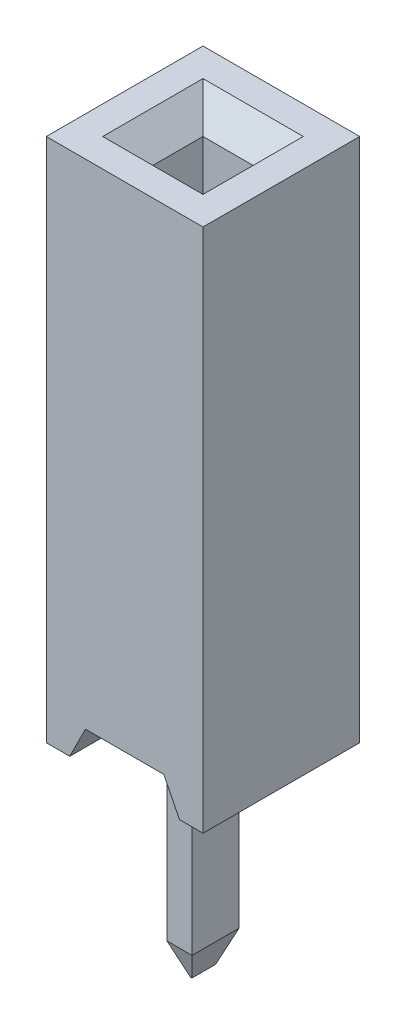
from build123d import *
from OCP.BRepFilletAPI import BRepFilletAPI_MakeChamfer

# Parameters (mm, degrees)
SKETCH1_W           = 2.54
SKETCH1_H           = 2.54
BOSS_EXTRUDE1_DEPTH = 8.509
CUT_EXTRUDE1_DEPTH  = 2.54
SKETCH3_W           = 0.4064
SKETCH3_H           = 0.762
BOSS_EXTRUDE3_DEPTH = 3.7084
CHAMFER2_SIZE       = 0.508
CHAMFER2_SIZE2      = 0.1905
SKETCH2_W           = 0.8128
SKETCH2_H           = 0.8128
CUT_EXTRUDE2_DEPTH  = 6.35
CHAMFER3_SIZE       = 0.4064


with BuildPart() as part:
    # Sketch1 → Boss-Extrude1 (new body)
    with BuildSketch(Plane(origin=(0, 0, 0), x_dir=(1, 0, 0), z_dir=(0, 1, 0))):
        with Locations((1.27, 1.27)):
            Rectangle(SKETCH1_W, SKETCH1_H)
    extrude(amount=BOSS_EXTRUDE1_DEPTH)

    # Sketch4 → Cut-Extrude1 (cut)
    with BuildSketch(Plane(origin=(0, 0, -2.54), x_dir=(-1, 0, 0), z_dir=(0, 0, -1))):
        Polygon((-0.635, 0.508), (-1.905, 0.508), (-2.159, 0), (-0.381, 0), align=None)
    extrude(amount=-CUT_EXTRUDE1_DEPTH, mode=Mode.SUBTRACT)

    # Sketch3 → Boss-Extrude3 (add)
    with BuildSketch(Plane.XZ.offset(-0.508)):
        with Locations((1.27, -1.27)):
            Rectangle(SKETCH3_W, SKETCH3_H)
    extrude(amount=BOSS_EXTRUDE3_DEPTH)

    # Chamfer2: one chamfer whose edges measure the first distance from different faces: ONE call of the kernel's chamfer builder (chamfer() names one face for all edges)
    chamfer2_edges_1 = [part.edges().sort_by_distance(p)[0] for p in [
        (1.4732, -3.2004, -1.27),
    ]]
    chamfer2_side_1 = [part.faces().sort_by_distance(p)[0] for p in [
        (1.4732, -1.3462, -1.27),
    ]]
    chamfer2_edges_2 = [part.edges().sort_by_distance(p)[0] for p in [
        (1.27, -3.2004, -1.651),
    ]]
    chamfer2_side_2 = [part.faces().sort_by_distance(p)[0] for p in [
        (1.27, -1.3462, -1.651),
    ]]
    chamfer2_edges_3 = [part.edges().sort_by_distance(p)[0] for p in [
        (1.0668, -3.2004, -1.27),
    ]]
    chamfer2_side_3 = [part.faces().sort_by_distance(p)[0] for p in [
        (1.0668, -1.3462, -1.27),
    ]]
    chamfer2_edges_4 = [part.edges().sort_by_distance(p)[0] for p in [
        (1.27, -3.2004, -0.889),
    ]]
    chamfer2_side_4 = [part.faces().sort_by_distance(p)[0] for p in [
        (1.27, -1.3462, -0.889),
    ]]
    chamfer2 = BRepFilletAPI_MakeChamfer(part.part.solid().wrapped)
    for e in chamfer2_edges_1:
        chamfer2.Add(CHAMFER2_SIZE, CHAMFER2_SIZE2, e.wrapped, chamfer2_side_1[0].wrapped)  # the first distance lies on this face
    for e in chamfer2_edges_2:
        chamfer2.Add(CHAMFER2_SIZE, CHAMFER2_SIZE2, e.wrapped, chamfer2_side_2[0].wrapped)  # the first distance lies on this face
    for e in chamfer2_edges_3:
        chamfer2.Add(CHAMFER2_SIZE, CHAMFER2_SIZE2, e.wrapped, chamfer2_side_3[0].wrapped)  # the first distance lies on this face
    for e in chamfer2_edges_4:
        chamfer2.Add(CHAMFER2_SIZE, CHAMFER2_SIZE2, e.wrapped, chamfer2_side_4[0].wrapped)  # the first distance lies on this face
    add(Compound.cast(chamfer2.Shape()), mode=Mode.REPLACE)

    # Sketch2 → Cut-Extrude2 (cut)
    with BuildSketch(Plane(origin=(0, 8.509, 0), x_dir=(1, 0, 0), z_dir=(0, 1, 0))):
        with Locations((1.27, 1.27)):
            Rectangle(SKETCH2_W, SKETCH2_H)
    extrude(amount=-CUT_EXTRUDE2_DEPTH, mode=Mode.SUBTRACT)

    # Chamfer3
    chamfer3_edges = [part.edges().sort_by_distance(p)[0] for p in [
        (1.27, 8.509, -1.6764),
        (0.8636, 8.509, -1.27),
        (1.27, 8.509, -0.8636),
        (1.6764, 8.509, -1.27),
    ]]
    chamfer(chamfer3_edges, length=CHAMFER3_SIZE)


solid = part.part
